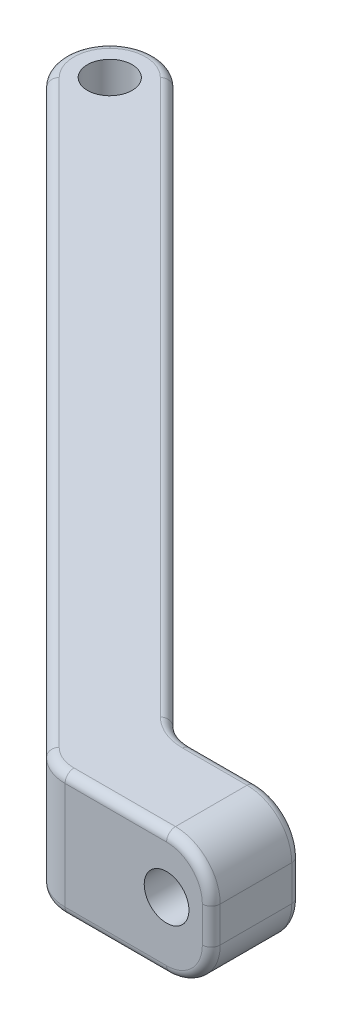
from build123d import *

# Parameters (mm, degrees)
SKETCH1_R           = 2.5
BOSS_EXTRUDE1_DEPTH = 13.97
CUT_EXTRUDE1_REACH  = 108.146
SKETCH2_R           = 2.5
FILLET1_R           = 5
FILLET2_R           = 1


with BuildPart() as part:
    # Sketch1 → Boss-Extrude1 (new body)
    with BuildSketch(Plane(origin=(0, 0, 0), x_dir=(1, 0, 0), z_dir=(0, 1, 0))):
        Polygon((0, 7.071067812), (-7.071067812, 0), (62.778932188, -69.85), (81.2, -69.85), (81.2, -59.85), (66.921067812, -59.85), align=None)
        with Locations(Location((0, 0, 0), (0, 0, 270))):
            Circle(SKETCH1_R, mode=Mode.SUBTRACT)
    extrude(amount=BOSS_EXTRUDE1_DEPTH)

    # Sketch2 → Cut-Extrude1 (cut, up to next)
    with BuildSketch(Plane(origin=(0, 0, 59.85), x_dir=(-1, 0, 0), z_dir=(0, 0, -1)), mode=Mode.PRIVATE) as cut_extrude1_sk1:
        with Locations((-76.2, 7.62)):
            Circle(SKETCH2_R)
    cut_extrude1_tool1 = extrude(cut_extrude1_sk1.sketch, amount=-CUT_EXTRUDE1_REACH, mode=Mode.PRIVATE) & part.part
    add(cut_extrude1_tool1.solids().sort_by_distance((76.2, 7.62, 59.85))[0], mode=Mode.SUBTRACT)

    # Fillet1
    fillet1_edges = [part.edges().sort_by_distance(p)[0] for p in [
        (0, 6.985, -7.071067812),
        (-7.071067812, 6.985, 0),
        (81.2, 0, 64.85),
        (81.2, 13.97, 64.85),
        (62.778932188, 6.985, 69.85),
        (66.921067812, 6.985, 59.85),
    ]]
    fillet(fillet1_edges, radius=FILLET1_R - 0.0001)  # a hair under: the kernel refuses the full size

    # Fillet2
    fillet2_edges = [part.edges().sort_by_distance(p)[0] for p in [
        (70.525029289, 0, 69.85),
        (28.889445383, 0, 35.960513195),
        (34.496047101, 0, 27.424979289),
        (72.596097101, 0, 59.85),
        (62.936579685, 0, 69.469405275),
        (-5.000041421, 0, 0),
        (0, 0, -5.000041421),
        (34.496047101, 13.97, 27.424979289),
        (72.596097101, 13.97, 59.85),
        (28.889445383, 13.97, 35.960513195),
        (70.525029289, 13.97, 69.85),
        (62.936579685, 13.97, 69.469405275),
        (-5.000041421, 13.97, 0),
        (0, 13.97, -5.000041421),
        (81.2, 6.985, 59.85),
        (81.2, 6.985, 69.85),
        (79.735563195, 12.505563195, 59.85),
        (79.735563195, 1.464436805, 59.85),
        (79.735563195, 12.505563195, 69.85),
        (79.735563195, 1.464436805, 69.85),
        (67.078715309, 0, 59.469405275),
        (67.078715309, 13.97, 59.469405275),
    ]]
    fillet(fillet2_edges, radius=FILLET2_R)


solid = part.part
